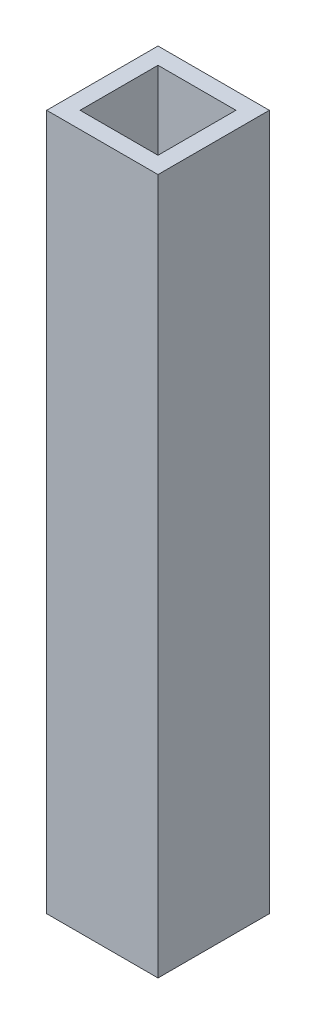
from build123d import *

# Parameters (mm, degrees)
SKETCH1_W           = 20
SKETCH1_H           = 125
BOSS_EXTRUDE1_DEPTH = 20
SHELL1_T            = -3


with BuildPart() as part:
    # Sketch1 → Boss-Extrude1 (new body)
    with BuildSketch(Plane.XY):
        Rectangle(SKETCH1_W, SKETCH1_H)
    extrude(amount=BOSS_EXTRUDE1_DEPTH)

    # Shell1
    shell1_openings = [part.faces().sort_by_distance(p)[0] for p in [
        (0, -62.5, 10),
        (0, 62.5, 10),
    ]]
    offset(amount=SHELL1_T, openings=shell1_openings, kind=Kind.INTERSECTION)


solid = part.part
